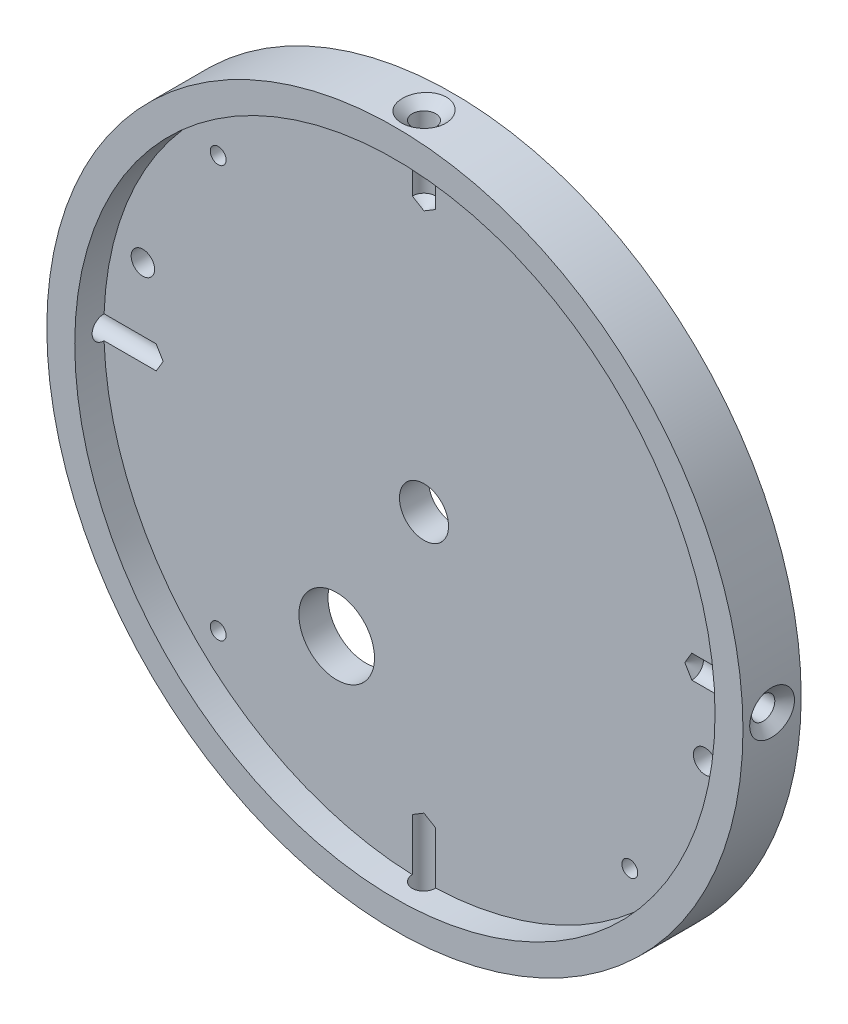
from build123d import *

# Parameters (mm, degrees)
BULKHEAD_BODY_PROFILE_R          = 75.946
BULKHEAD_BODY_DEPTH              = 12.7
BULKHEAD_INSIDE_PROFILE_R        = 69.85
BULKHEAD_INSIDE_CUT_DEPTH        = 6.35
BULKHEAD_INSIDE_HOLE_PROFILE_R   = 5.35813
BULKHEAD_INSIDE_HOLE_PROFILE_R_2 = 8.2499962
BULKHEAD_INSIDE_HOLE_PROFILE_R_3 = 2.5527
BULKHEAD_INSIDE_HOLE_PROFILE_R_4 = 1.7272
BULKHEAD_INSIDE_HOLES_DEPTH      = 108.59141384
SHEAR_PIN_PATTERN_COUNT          = 4


with BuildPart() as part:
    # Bulkhead Body Profile → Bulkhead Body (new body)
    with BuildSketch(Plane.XY):
        Circle(BULKHEAD_BODY_PROFILE_R)
    extrude(amount=BULKHEAD_BODY_DEPTH)

    # Bulkhead Inside Profile → Bulkhead Inside Cut (cut)
    with BuildSketch(Plane.XY.offset(12.7)):
        Circle(BULKHEAD_INSIDE_PROFILE_R)
    extrude(amount=-BULKHEAD_INSIDE_CUT_DEPTH, mode=Mode.SUBTRACT)

    # Bulkhead Inside Hole Profile → Bulkhead Inside Holes (cut, through all)
    with BuildSketch(Plane.XY.offset(6.35)):
        Circle(BULKHEAD_INSIDE_HOLE_PROFILE_R)
        with Locations((-19.05, -32.995567884)):
            Circle(BULKHEAD_INSIDE_HOLE_PROFILE_R_2)
        with Locations((-61.336289969, 16.435009364)):
            Circle(BULKHEAD_INSIDE_HOLE_PROFILE_R_3)
        with Locations((61.336289969, -16.435009364)):
            Circle(BULKHEAD_INSIDE_HOLE_PROFILE_R_3)
        with Locations((44.901280605, 44.901280605)):
            Circle(BULKHEAD_INSIDE_HOLE_PROFILE_R_4)
        with Locations((-44.901280605, 44.901280605)):
            Circle(BULKHEAD_INSIDE_HOLE_PROFILE_R_4)
        with Locations((-44.901280605, -44.901280605)):
            Circle(BULKHEAD_INSIDE_HOLE_PROFILE_R_4)
        with Locations((44.901280605, -44.901280605)):
            Circle(BULKHEAD_INSIDE_HOLE_PROFILE_R_4)
    extrude(amount=-BULKHEAD_INSIDE_HOLES_DEPTH, mode=Mode.SUBTRACT)

    # Sketch5 → Shear Pin Cut (revolve, cut)
    with BuildSketch(Plane(origin=(0, 75.946, 6.35), x_dir=(0, 0, 1), z_dir=(1, 0, 0))):
        Polygon((0, 0), (0, 19.05), (2.5527, 17.516183098), (2.5527, 1.960808018), (4.8895, 0), align=None)
    shear_pin_cut = revolve(axis=Axis((0, 82.296, 6.35), (0, -1, 0)), mode=Mode.SUBTRACT)

    # Shear Pin Pattern: Shear Pin Cut ×4 about axis
    shear_pin_pattern_axis = Axis((0, 0, 12.7), (0, 0, 1))
    for i in range(1, SHEAR_PIN_PATTERN_COUNT):
        add(shear_pin_cut.rotate(shear_pin_pattern_axis, i * 360 / SHEAR_PIN_PATTERN_COUNT), mode=Mode.SUBTRACT)


solid = part.part
